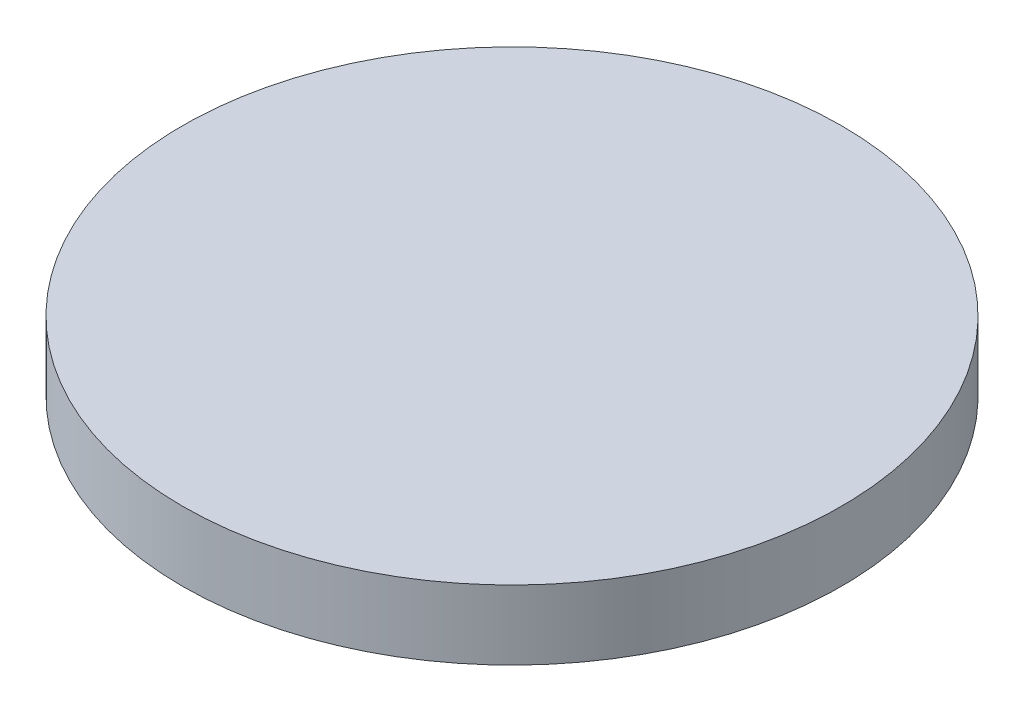
from build123d import *

# Parameters (mm, degrees)
SKETCH_1_R      = 19
EXTRUDE_1_DEPTH = 4


with BuildPart() as part:
    # Эскиз1 → Бобышка-Вытянуть1 (new body)
    with BuildSketch(Plane(origin=(0, 0, 0), x_dir=(1, 0, 0), z_dir=(0, 1, 0))):
        Circle(SKETCH_1_R)
    extrude(amount=EXTRUDE_1_DEPTH)


solid = part.part
